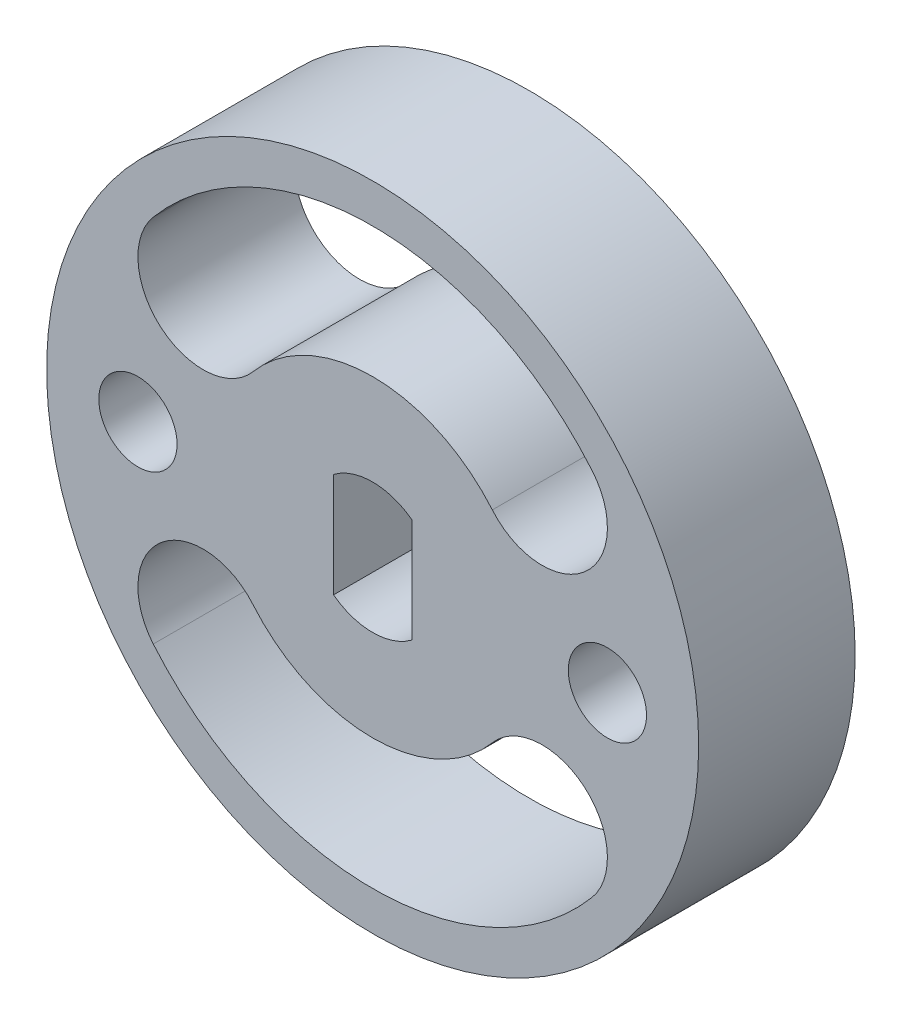
from build123d import *
from build123d.topology import SkipClean

# Parameters (mm, degrees)
BOSS_EXTRUDE1_DEPTH = 6000
CUT_EXTRUDE1_DEPTH  = 18669.154702594


with BuildPart() as part:
    # Sketch1 → Boss-Extrude1 (new body)
    with BuildSketch(Plane.XY):
        with BuildLine():
            Line((1500, 2000), (1500, 0))
            Line((1500, 0), (7500, 0))
            ThreePointArc((7500, 0), (9000, 1500), (10500, 0))
            Line((10500, 0), (12500, 0))
            ThreePointArc((12500, 0), (8838.834764832, 8838.834764832), (0, 12500))
            Line((0, 12500), (0, 2500))
            ThreePointArc((0, 2500), (790.569415042, 2371.708245126), (1500, 2000))
        make_face()
    extrude(amount=BOSS_EXTRUDE1_DEPTH)

    # Mirror4: part across plane


with BuildPart() as part_1:
    add(part.part)
    add(part.part.mirror(Plane(origin=(0, 12500, 6000), x_dir=(0, 0, 1), z_dir=(1, 0, 0))))

    # Sketch2 → Cut-Extrude1 (cut, through all)
    with BuildSketch(Plane.XY.offset(6000)):
        with BuildLine():
            ThreePointArc((8411.764705882, 7088.174273596), (0, 11000), (-8411.764705882, 7088.174273596))
            ThreePointArc((-8411.764705882, 7088.174273596), (-8110.948698545, 3565.460869169), (-4588.235294118, 3866.276876507))
            ThreePointArc((-4588.235294118, 3866.276876507), (0, 6000), (4588.235294118, 3866.276876507))
            ThreePointArc((4588.235294118, 3866.276876507), (8110.948698545, 3565.460869169), (8411.764705882, 7088.174273596))
        make_face()
    extrude(amount=-CUT_EXTRUDE1_DEPTH, mode=Mode.SUBTRACT)

    # Mirror5: part across plane


with BuildPart() as part_2:
    with SkipClean():  # the faces are left unmerged after this step: merging them gives an invalid solid
        add(part_1.part)
        add(part_1.part.mirror(Plane(origin=(-1500, 0, 6000), x_dir=(0, 0, 1), z_dir=(0, 1, 0))))


solid = part_2.part
